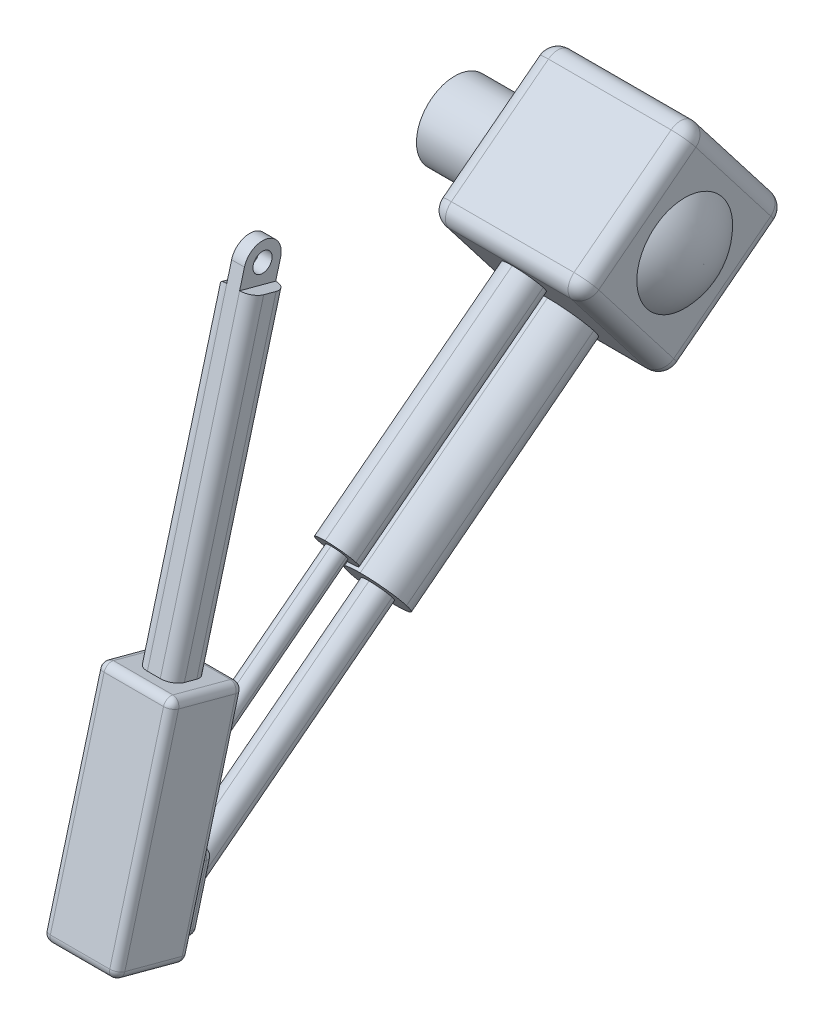
from build123d import *

# Parameters (mm, degrees)
BOSS_EXTRUDE1_DEPTH  = 100
SKETCH5_R            = 50
BOSS_EXTRUDE2_DEPTH  = 100
BOSS_EXTRUDE3_DEPTH  = 100
BOSS_EXTRUDE4_DEPTH  = 37.5
BOSS_EXTRUDE5_DEPTH  = 37.5
BOSS_EXTRUDE6_DEPTH  = 25
BOSS_EXTRUDE7_DEPTH  = 25
BOSS_EXTRUDE8_DEPTH  = 18.75
BOSS_EXTRUDE9_DEPTH  = 18.75
BOSS_EXTRUDE10_DEPTH = 12.5
BOSS_EXTRUDE11_DEPTH = 12.5
BOSS_EXTRUDE12_DEPTH = 27.5
BOSS_EXTRUDE13_DEPTH = 27.5
BOSS_EXTRUDE14_DEPTH = 33.75
BOSS_EXTRUDE15_DEPTH = 33.75
SKETCH9_W            = 97.5
SKETCH9_H            = 290.87550519886753
BOSS_EXTRUDE17_DEPTH = 48.75
SKETCH11_W           = 97.5
SKETCH11_H           = 290.8755051988676
BOSS_EXTRUDE18_DEPTH = 48.75
SKETCH11_3_W         = 48.749999999999986
SKETCH11_3_H         = 400.00000000000006
BOSS_EXTRUDE19_DEPTH = 24.375
SKETCH11_4_W         = 48.749999999999986
SKETCH11_4_H         = 400.00000000000006
BOSS_EXTRUDE20_DEPTH = 24.375
SKETCH12_R           = 62.5
BOSS_EXTRUDE21_DEPTH = 25
FILLET1_R            = 90
SKETCH13_R           = 12.500000000000005
BOSS_EXTRUDE22_DEPTH = 32.75
SKETCH13_4_R         = 24.374999999999968
SKETCH13_4_R_2       = 12.500000000000005
CUT_EXTRUDE1_DEPTH   = 16
FILLET2_R            = 20
FILLET3_R            = 25
FILLET4_R            = 12.5
FILLET5_R            = 37.5
FILLET6_R            = 18.75
FILLET7_R            = 10
FILLET8_R            = 16


# Some blends are built 0.0001 mm under size
with BuildPart() as part:
    # Sketch4 → Boss-Extrude1 (new body)
    with BuildSketch(Plane(origin=(0, 0, 0), x_dir=(0, 0, -1), z_dir=(1, 0, 0))):
        Polygon((-18.016212694338478, -140.26908454877824), (140.26908454877824, -18.016212694338257), (18.01621269433834, 140.26908454877835), (-140.26908454877835, 18.0162126943387), align=None)
    extrude(amount=BOSS_EXTRUDE1_DEPTH)

    # Sketch5 → Boss-Extrude2 (add)
    with BuildSketch(Plane.ZY):
        with Locations(Location((0, 0, 0), (0, 0, 270))):
            Circle(SKETCH5_R)
    extrude(amount=BOSS_EXTRUDE2_DEPTH)

    # Sketch7 → Boss-Extrude3 (add)
    with BuildSketch(Plane(origin=(99.99999999999976, 6.983e-13, 0), x_dir=(0, 0, -1), z_dir=(1, 6.98e-15, 0))):
        Polygon((140.26908454877824, -18.016212694338954), (18.01621269433834, 140.26908454877764), (-140.26908454877835, 18.016212694338005), (-18.016212694338478, -140.26908454877892), align=None)
    extrude(amount=BOSS_EXTRUDE3_DEPTH)

    # Sketch7<4> → Boss-Extrude4 (add)
    with BuildSketch(Plane(origin=(99.99999999999976, 6.983e-13, 0), x_dir=(0, 0, -1), z_dir=(1, 6.98e-15, 0))):
        Polygon((-33.29782167614346, -120.4834223933893), (-79.1426486215579, -61.126435927221124), (-323.32667424661275, -249.72385409291445), (-311.86546751025963, -264.5631007094558), (-288.94305403755214, -294.2415939425403), (-277.4818473011984, -309.08084055908245), align=None)
    extrude(amount=BOSS_EXTRUDE4_DEPTH)

    # Sketch7<5> → Boss-Extrude5 (add)
    with BuildSketch(Plane(origin=(99.99999999999976, 6.983e-13, 0), x_dir=(0, 0, -1), z_dir=(1, 6.98e-15, 0))):
        Polygon((-33.29782167614346, -120.4834223933893), (-79.1426486215579, -61.126435927221124), (-323.32667424661275, -249.72385409291445), (-311.86546751025963, -264.5631007094558), (-288.94305403755214, -294.2415939425403), (-277.4818473011984, -309.08084055908245), align=None)
    extrude(amount=-BOSS_EXTRUDE5_DEPTH)

    # Sketch7<6> → Boss-Extrude6 (add)
    with BuildSketch(Plane(origin=(99.99999999999976, 6.983e-13, 0), x_dir=(0, 0, -1), z_dir=(1, 6.98e-15, 0))):
        Polygon((-94.42425760336783, -41.3407737718251), (-124.98747556697336, -1.7694494610516216), (-369.17150119202836, -190.36686762674503), (-361.53069670112586, -200.2596987044398), (-346.2490877193208, -220.04536085982943), (-338.60828322842275, -229.93819193751852), align=None)
    extrude(amount=BOSS_EXTRUDE6_DEPTH)

    # Sketch7<7> → Boss-Extrude7 (add)
    with BuildSketch(Plane(origin=(99.99999999999976, 6.983e-13, 0), x_dir=(0, 0, -1), z_dir=(1, 6.98e-15, 0))):
        Polygon((-94.42425760336783, -41.3407737718251), (-124.98747556697336, -1.7694494610516216), (-369.17150119202836, -190.36686762674503), (-361.53069670112586, -200.2596987044398), (-346.2490877193208, -220.04536085982943), (-338.60828322842275, -229.93819193751852), align=None)
    extrude(amount=-BOSS_EXTRUDE7_DEPTH)

    # Sketch7<8> → Boss-Extrude8 (add)
    with BuildSketch(Plane(origin=(99.99999999999976, 6.983e-13, 0), x_dir=(0, 0, -1), z_dir=(1, 6.98e-15, 0))):
        Polygon((-288.94305403755214, -294.2415939425403), (-311.86546751025963, -264.5631007094558), (-549.3205994238973, -447.963405846006), (-565.3299608600691, -507.7111561225338), align=None)
    extrude(amount=BOSS_EXTRUDE8_DEPTH)

    # Sketch7<9> → Boss-Extrude9 (add)
    with BuildSketch(Plane(origin=(99.99999999999976, 6.983e-13, 0), x_dir=(0, 0, -1), z_dir=(1, 6.98e-15, 0))):
        Polygon((-288.94305403755214, -294.2415939425403), (-311.86546751025963, -264.5631007094558), (-549.3205994238973, -447.963405846006), (-565.3299608600691, -507.7111561225338), align=None)
    extrude(amount=-BOSS_EXTRUDE9_DEPTH)

    # Sketch7<10> → Boss-Extrude10 (add)
    with BuildSketch(Plane(origin=(99.99999999999976, 6.983e-13, 0), x_dir=(0, 0, -1), z_dir=(1, 6.98e-15, 0))):
        Polygon((-346.2490877193208, -220.04536085982943), (-361.53069670112586, -200.2596987044398), (-514.6336496455251, -318.50994691352884), (-525.3065572696396, -358.3417804312143), align=None)
    extrude(amount=BOSS_EXTRUDE10_DEPTH)

    # Sketch7<11> → Boss-Extrude11 (add)
    with BuildSketch(Plane(origin=(99.99999999999976, 6.983e-13, 0), x_dir=(0, 0, -1), z_dir=(1, 6.98e-15, 0))):
        Polygon((-346.2490877193208, -220.04536085982943), (-361.53069670112586, -200.2596987044398), (-514.6336496455251, -318.50994691352884), (-525.3065572696396, -358.3417804312143), align=None)
    extrude(amount=-BOSS_EXTRUDE11_DEPTH)

    # Sketch7<12> → Boss-Extrude12 (add)
    with BuildSketch(Plane(origin=(99.99999999999976, 6.983e-13, 0), x_dir=(0, 0, -1), z_dir=(1, 6.98e-15, 0))):
        Polygon((-525.3065572696396, -358.3417804312143), (-514.6336496455251, -318.50994691352884), (-510.75136396898733, -304.0210595191928), (-534.8995096262141, -297.55058339162974), (-553.336988603405, -366.3601916979868), (-529.1888429461774, -372.8306678255503), align=None)
    extrude(amount=BOSS_EXTRUDE12_DEPTH)

    # Sketch7<13> → Boss-Extrude13 (add)
    with BuildSketch(Plane(origin=(99.99999999999976, 6.983e-13, 0), x_dir=(0, 0, -1), z_dir=(1, 6.98e-15, 0))):
        Polygon((-525.3065572696396, -358.3417804312143), (-514.6336496455251, -318.50994691352884), (-510.75136396898733, -304.0210595191928), (-534.8995096262141, -297.55058339162974), (-553.336988603405, -366.3601916979868), (-529.1888429461774, -372.8306678255503), align=None)
    extrude(amount=-BOSS_EXTRUDE13_DEPTH)

    # Sketch7<14> → Boss-Extrude14 (add)
    with BuildSketch(Plane(origin=(99.99999999999976, 6.983e-13, 0), x_dir=(0, 0, -1), z_dir=(1, 6.98e-15, 0))):
        Polygon((-565.3299608600691, -507.7111561225338), (-549.3205994238973, -447.963405846006), (-545.4383137473595, -433.47451845167), (-569.5864594045863, -427.00404232410705), (-593.3603921938336, -515.729567389307), (-569.212246536607, -522.2000435168699), align=None)
    extrude(amount=BOSS_EXTRUDE14_DEPTH)

    # Sketch7<15> → Boss-Extrude15 (add)
    with BuildSketch(Plane(origin=(99.99999999999976, 6.983e-13, 0), x_dir=(0, 0, -1), z_dir=(1, 6.98e-15, 0))):
        Polygon((-565.3299608600691, -507.7111561225338), (-549.3205994238973, -447.963405846006), (-545.4383137473595, -433.47451845167), (-569.5864594045863, -427.00404232410705), (-593.3603921938336, -515.729567389307), (-569.212246536607, -522.2000435168699), align=None)
    extrude(amount=-BOSS_EXTRUDE15_DEPTH)

    # Sketch9 → Boss-Extrude17 (add)
    with BuildSketch(Plane(origin=(-7.9461e-13, 113.79276777475518, 424.680390869267), x_dir=(1, 4.7e-16, 1.75e-15), z_dir=(-1.807323732225277e-15, 0.25881904510252407, 0.9659258262890675))):
        with Locations((100.00000000000355, -521.2917260320522)):
            Rectangle(SKETCH9_W, SKETCH9_H)
    extrude(amount=BOSS_EXTRUDE17_DEPTH)

    # Sketch11 → Boss-Extrude18 (add)
    with BuildSketch(Plane(origin=(-6.0917e-13, 126.41019622350585, 471.7692749008552), x_dir=(1, 3.2e-16, 1.2e-15), z_dir=(-1.2472477168906274e-15, 0.25881904510253106, 0.9659258262890656))):
        with Locations((100.00000000000327, -521.2917260320559)):
            Rectangle(SKETCH11_W, SKETCH11_H)
    extrude(amount=BOSS_EXTRUDE18_DEPTH)

    # Sketch11<3> → Boss-Extrude19 (add)
    with BuildSketch(Plane(origin=(-6.0917e-13, 126.41019622350585, 471.7692749008552), x_dir=(1, 3.2e-16, 1.2e-15), z_dir=(-1.2472477168906274e-15, 0.25881904510253106, 0.9659258262890656))):
        with Locations((100.00000000000324, -175.85397343262204)):
            Rectangle(SKETCH11_3_W, SKETCH11_3_H)
    extrude(amount=BOSS_EXTRUDE19_DEPTH)

    # Sketch11<4> → Boss-Extrude20 (add)
    with BuildSketch(Plane(origin=(-6.0917e-13, 126.41019622350585, 471.7692749008552), x_dir=(1, 3.2e-16, 1.2e-15), z_dir=(-1.2472477168906274e-15, 0.25881904510253106, 0.9659258262890656))):
        with Locations((100.00000000000324, -175.85397343262204)):
            Rectangle(SKETCH11_4_W, SKETCH11_4_H)
    extrude(amount=-BOSS_EXTRUDE20_DEPTH)

    # Sketch12 → Boss-Extrude21 (add)
    with BuildSketch(Plane(origin=(199.99999999999974, 2.79398e-12, 0), x_dir=(0, 0, -1), z_dir=(1, 1.397e-14, 0))):
        with Locations(Location((0, 0, 0), (0, 0, 90))):
            Circle(SKETCH12_R)
    extrude(amount=BOSS_EXTRUDE21_DEPTH)

    # Fillet1
    # the kernel refuses this fillet: 90 mm, written as the material it takes off along each edge
    with BuildSketch(Plane(origin=(224.99999999999974, 3.14323e-12, 0), x_dir=(-1.41e-14, 1, -6e-17), z_dir=(0, -6e-17, -1))) as fillet1_piece_1:
        with BuildLine():
            CenterArc((0.25050201005633005, -90), FILLET1_R, 46.23825730732019, 43.761742692679825)
            Line((0.25050201005631856, 3.53e-15), (0.25050201005631834, 1.800000000000015))
            Line((0.25050201005631834, 1.800000000000015), (62.5, 1.8000000000000114))
            Line((62.5, 1.8000000000000114), (64.3, -3.05e-15))
            ThreePointArc((64.3, -3.05e-15), (64.3, -12.500000000000004), (63.74498995979888, -23.7))
            Line((63.74498995979888, -23.7), (62.50000000000001, -25))
        make_face()
    revolve(axis=Axis((224.99999999999974, 3.14323e-12, 0), (1, 1.397e-14, 0)), mode=Mode.SUBTRACT)

    # Sketch13 → Boss-Extrude22 (add)
    with BuildSketch(Plane(origin=(124.37500000000372, 9.0866e-13, 1.4984e-13), x_dir=(1.2e-15, 0, -1), z_dir=(1, 7.31e-15, 1.2e-15))):
        with BuildLine():
            Line((-441.9753813458701, 143.4247526628231), (-435.66666712149606, 166.96919467861932))
            ThreePointArc((-435.66666712149606, 166.96919467861932), (-452.90239491291806, 196.8223509187893), (-482.75555115308805, 179.58662312736732))
            Line((-482.7555511530881, 179.58662312736735), (-489.06426537746205, 156.0421811115715))
            Line((-489.06426537746205, 156.0421811115715), (-441.9753813458701, 143.4247526628231))
        make_face()
        with Locations(Location((-459.21110913729206, 173.27790890299332, 0), (0, 0, 90))):
            Circle(SKETCH13_R, mode=Mode.SUBTRACT)
    extrude(amount=-BOSS_EXTRUDE22_DEPTH)

    # Sketch13<4> → Cut-Extrude1 (cut)
    # profile 1 of 3: a face of its own
    with BuildSketch(Plane(origin=(124.37500000000372, 9.0866e-13, 1.4984e-13), x_dir=(1.2e-15, 0, -1), z_dir=(1, 7.31e-15, 1.2e-15))):
        with BuildLine():
            Line((-465.5198234930759, 149.73346692240844), (-441.9753813458701, 143.4247526628231))
            Line((-441.9753813458701, 143.4247526628231), (-435.66666712149606, 166.96919467861932))
            ThreePointArc((-435.66666712149606, 166.96919467861932), (-447.02360919620156, 152.16853965173627), (-465.5198234930759, 149.73346692240847))
        make_face()
    # profile 2 of 3: a face of its own
    with BuildSketch(Plane(origin=(124.37500000000372, 9.0866e-13, 1.4984e-13), x_dir=(1.2e-15, 0, -1), z_dir=(1, 7.31e-15, 1.2e-15))):
        with Locations((-459.21110913729206, 173.27790890299332)):
            Circle(SKETCH13_4_R)
        with Locations(Location((-459.21110913729206, 173.27790890299332, 0), (0, 0, 90))):
            Circle(SKETCH13_4_R_2, mode=Mode.SUBTRACT)
    # profile 3 of 3: a face of its own
    with BuildSketch(Plane(origin=(124.37500000000372, 9.0866e-13, 1.4984e-13), x_dir=(1.2e-15, 0, -1), z_dir=(1, 7.31e-15, 1.2e-15))):
        with BuildLine():
            Line((-489.06426537746205, 156.0421811115715), (-465.5198234930759, 149.73346692240844))
            ThreePointArc((-465.5198234930759, 149.73346692240847), (-480.32047838854913, 161.0904089619028), (-482.75555115308805, 179.58662312736732))
            Line((-482.7555511530881, 179.58662312736735), (-489.06426537746205, 156.0421811115715))
        make_face()
    extrude(amount=-CUT_EXTRUDE1_DEPTH, mode=Mode.SUBTRACT)

    # Fillet2
    fillet2_edges = [part.edges().sort_by_distance(p)[0] for p in [
        (199.99999999999935, 61.12643592722074, -79.1426486215583),
        (199.99999999999923, 79.1426486215592, 61.12643592722003),
        (200.0000000000002, -61.126435927219056, 79.14264862155841),
        (200.0000000000003, -79.14264862155753, -61.12643592721989),
        (0, 79.14264862155852, 61.12643592722003),
        (0, 61.126435927220065, -79.14264862155828),
        (0, -79.14264862155824, -61.12643592721989),
        (0, -61.12643592721976, 79.14264862155841),
        (99.99999999999983, 18.016212694339053, 140.26908454877835),
        (99.9999999999994, 140.2690845487787, -18.01621269433834),
        (99.99999999999994, -18.01621269433791, -140.26908454877824),
        (100.00000000000037, -140.26908454877787, 18.016212694338478),
    ]]
    fillet(fillet2_edges, radius=FILLET2_R)

    # Fillet3
    fillet3_edges = [part.edges().sort_by_distance(p)[0] for p in [
        (125.00000000000071, -135.6394828546709, 216.51627041589526),
        (125.00000000000043, -96.06815854389748, 247.07948837950087),
        (75.00000000000071, -135.63948285467126, 216.51627041589526),
        (75.00000000000043, -96.06815854389782, 247.07948837950087),
    ]]
    fillet(fillet3_edges, radius=FILLET3_R - 0.0001)  # a hair under: the kernel refuses the full size

    # Fillet4
    fillet4_edges = [part.edges().sort_by_distance(p)[0] for p in [
        (87.50000000000178, -289.1935706455212, 435.77782249448023),
        (112.50000000000156, -259.38482280898353, 438.0821731733255),
        (87.50000000000156, -259.3848228089837, 438.0821731733255),
        (112.50000000000178, -289.19357064552105, 435.77782249448023),
    ]]
    fillet(fillet4_edges, radius=FILLET4_R - 0.0001)  # a hair under: the kernel refuses the full size

    # Fillet5
    fillet5_edges = [part.edges().sort_by_distance(p)[0] for p in [
        (62.500000000000846, -155.42514501006733, 201.23466143408527),
        (62.50000000000126, -214.78213147623538, 155.38983448867086),
        (137.50000000000128, -214.78213147623484, 155.38983448867086),
        (137.50000000000085, -155.42514501006679, 201.23466143408527),
    ]]
    fillet(fillet5_edges, radius=FILLET5_R - 0.0001)  # a hair under: the kernel refuses the full size

    # Fillet6
    fillet6_edges = [part.edges().sort_by_distance(p)[0] for p in [
        (118.75000000000256, -400.97637503253617, 427.1365074488107),
        (81.25000000000256, -400.97637503253645, 427.1365074488107),
        (118.75000000000225, -356.26325327773003, 430.5930334670785),
        (81.25000000000225, -356.2632532777303, 430.5930334670785),
    ]]
    fillet(fillet6_edges, radius=FILLET6_R - 0.0001)  # a hair under: the kernel refuses the full size

    # Fillet7
    fillet7_edges = [part.edges().sort_by_distance(p)[0] for p in [
        (100.00000000000236, -372.83066782554954, 529.1888429461774),
        (127.50000000000186, -300.78582145541037, 522.8254367976008),
        (100.00000000000188, -304.02105951919214, 510.75136396898733),
        (127.50000000000234, -369.5954297617676, 541.2629157747912),
        (127.50000000000212, -338.4258636723706, 519.9701034575824),
        (72.50000000000212, -338.42586367237107, 519.9701034575824),
        (72.50000000000186, -300.78582145541077, 522.8254367976008),
        (72.50000000000234, -369.595429761768, 541.2629157747912),
        (100.00000000000341, -522.2000435168692, 569.212246536607),
        (100.0000000000028, -433.4745184516693, 545.4383137473595),
        (133.75000000000313, -477.837280984269, 557.3252801419833),
        (133.75000000000279, -430.2392803878876, 557.5123865759729),
        (133.7500000000034, -518.9648054530876, 581.2863193652203),
        (66.2500000000031, -477.83728098426946, 557.3252801419833),
        (66.25000000000338, -518.964805453088, 581.2863193652203),
        (66.25000000000276, -430.2392803878881, 557.5123865759729),
        (148.75000000000276, -389.736373430409, 559.6006176207296),
        (148.75000000000267, -517.6010263348937, 644.3315619019651),
        (100.00000000000276, -249.25429207717593, 521.958557371087),
        (148.75000000000267, -236.63686362842782, 569.0474414026788),
        (51.25000000000275, -389.73637343040906, 559.6006176207294),
        (51.25000000000267, -236.63686362842788, 569.0474414026787),
        (100.00000000000276, -530.2184547836422, 597.2426778703721),
        (51.25000000000267, -517.6010263348938, 644.3315619019648),
        (100.0000000000026, -224.01943517967973, 616.1363254342706),
        (51.2500000000026, -364.50151653291255, 653.7783856839142),
        (100.0000000000026, -504.9835978861454, 691.4204459335579),
        (148.7500000000026, -364.50151653291255, 653.7783856839143),
    ]]
    fillet(fillet7_edges, radius=FILLET7_R)

    # Fillet8
    fillet8_edges = [part.edges().sort_by_distance(p)[0] for p in [
        (75.62500000000264, 149.73346688719815, 465.51982336166617),
        (75.62500000000267, -49.76041259498918, 493.73919036637636),
        (75.62500000000261, -37.14298414624079, 540.8280743979684),
        (124.37500000000225, -37.142984146240735, 540.8280743979685),
        (124.37500000000234, -49.760412594989134, 493.7391903663766),
    ]]
    fillet(fillet8_edges, radius=FILLET8_R - 0.0001)  # a hair under: the kernel refuses the full size


solid = part.part
